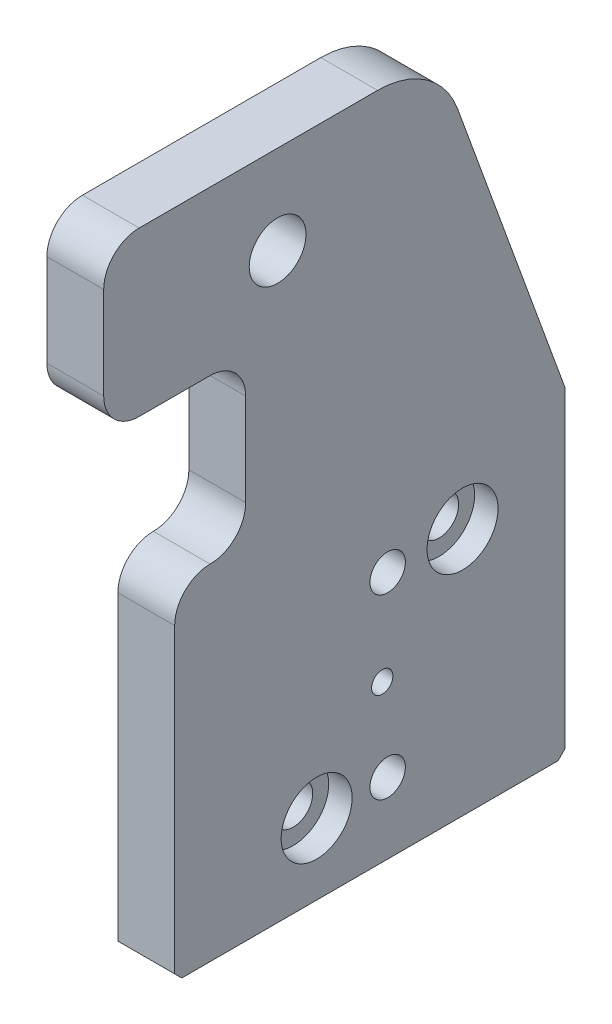
from build123d import *

# Parameters (mm, degrees)
BOSS_EXTRUDE1_DEPTH                         = 8
FILLET1_R                                   = 12
FILLET2_R                                   = 5
FILLET3_R                                   = 5
CHAMFER2_SIZE                               = 1
F_5_0MM_DOWEL_HOLE3_D                       = 5
F_3_0MM_DOWEL_HOLE1_D                       = 3
CBORE_FOR_M5_CHEESE_HEAD_SCREW5_D           = 5.5
CBORE_FOR_M5_CHEESE_HEAD_SCREW5_CBORE_D     = 10
CBORE_FOR_M5_CHEESE_HEAD_SCREW5_CBORE_DEPTH = 3.3
CBORE_FOR_M5_CHEESE_HEAD_SCREW6_D           = 5.5
CBORE_FOR_M5_CHEESE_HEAD_SCREW6_CBORE_D     = 10
CBORE_FOR_M5_CHEESE_HEAD_SCREW6_CBORE_DEPTH = 3.3
F_8_0MM_DOWEL_HOLE3_D                       = 8


with BuildPart() as part:
    # Sketch1 → Boss-Extrude1 (new body)
    with BuildSketch(Plane(origin=(0, 0, 0), x_dir=(0, 0, -1), z_dir=(1, 0, 0))):
        Polygon((65, 0), (65, 45), (46.983473404, 94.5), (0, 94.5), (0, 71.5), (20, 71.5), (20, 48.5), (10, 48.5), (10, 0), align=None)
    extrude(amount=BOSS_EXTRUDE1_DEPTH)

    # Fillet1
    fillet1_edges = [part.edges().sort_by_distance(p)[0] for p in [
        (4, 94.5, -46.983473404),
    ]]
    fillet(fillet1_edges, radius=FILLET1_R)

    # Fillet2
    fillet2_edges = [part.edges().sort_by_distance(p)[0] for p in [
        (4, 94.5, 0),
    ]]
    fillet(fillet2_edges, radius=FILLET2_R)

    # Fillet3
    fillet3_edges = [part.edges().sort_by_distance(p)[0] for p in [
        (4, 48.5, -20),
        (4, 71.5, -20),
    ]]
    fillet(fillet3_edges, radius=FILLET3_R)
    fillet3_2_edges = [part.edges().sort_by_distance(p)[0] for p in [
        (4, 48.5, -10),
        (4, 71.5, 0),
    ]]
    fillet(fillet3_2_edges, radius=FILLET3_R - 0.0001)  # a hair under: the kernel refuses the full size

    # Chamfer2
    chamfer2_edges = [part.edges().sort_by_distance(p)[0] for p in [
        (4, 0, -65),
        (4, 0, -10),
    ]]
    chamfer(chamfer2_edges, length=CHAMFER2_SIZE)

    # Ø5.0mm Dowel Hole3 (through all)
    with Locations(Plane(origin=(0, 0, 0), x_dir=(0, 0, -1), z_dir=(-1, 0, 0))):
        with Locations((40, -35), (40, -10.001113523)):
            Hole(F_5_0MM_DOWEL_HOLE3_D / 2)

    # Ø3.0mm Dowel Hole1 (through all)
    with Locations(Plane(origin=(0, 0, 0), x_dir=(0, 0, -1), z_dir=(-1, 0, 0))):
        with Locations((39.239701592, -22)):
            Hole(F_3_0MM_DOWEL_HOLE1_D / 2)

    # CBORE for M5 Cheese Head Screw5 (through all)
    with Locations(Plane(origin=(8, 0, 0), x_dir=(0, 0, -1), z_dir=(1, 0, 0))):
        with Locations((30, 10.001113523)):
            CounterBoreHole(CBORE_FOR_M5_CHEESE_HEAD_SCREW5_D / 2, CBORE_FOR_M5_CHEESE_HEAD_SCREW5_CBORE_D / 2, CBORE_FOR_M5_CHEESE_HEAD_SCREW5_CBORE_DEPTH)

    # CBORE for M5 Cheese Head Screw6 (through all)
    with Locations(Plane(origin=(8, 0, 0), x_dir=(0, 0, -1), z_dir=(1, 0, 0))):
        with Locations((50.552772121, 35)):
            CounterBoreHole(CBORE_FOR_M5_CHEESE_HEAD_SCREW6_D / 2, CBORE_FOR_M5_CHEESE_HEAD_SCREW6_CBORE_D / 2, CBORE_FOR_M5_CHEESE_HEAD_SCREW6_CBORE_DEPTH)

    # Ø8.0mm Dowel Hole3 (through all)
    with Locations(Plane(origin=(0, 0, 0), x_dir=(0, 0, -1), z_dir=(-1, 0, 0))):
        with Locations((24.5, -82)):
            Hole(F_8_0MM_DOWEL_HOLE3_D / 2)


solid = part.part
